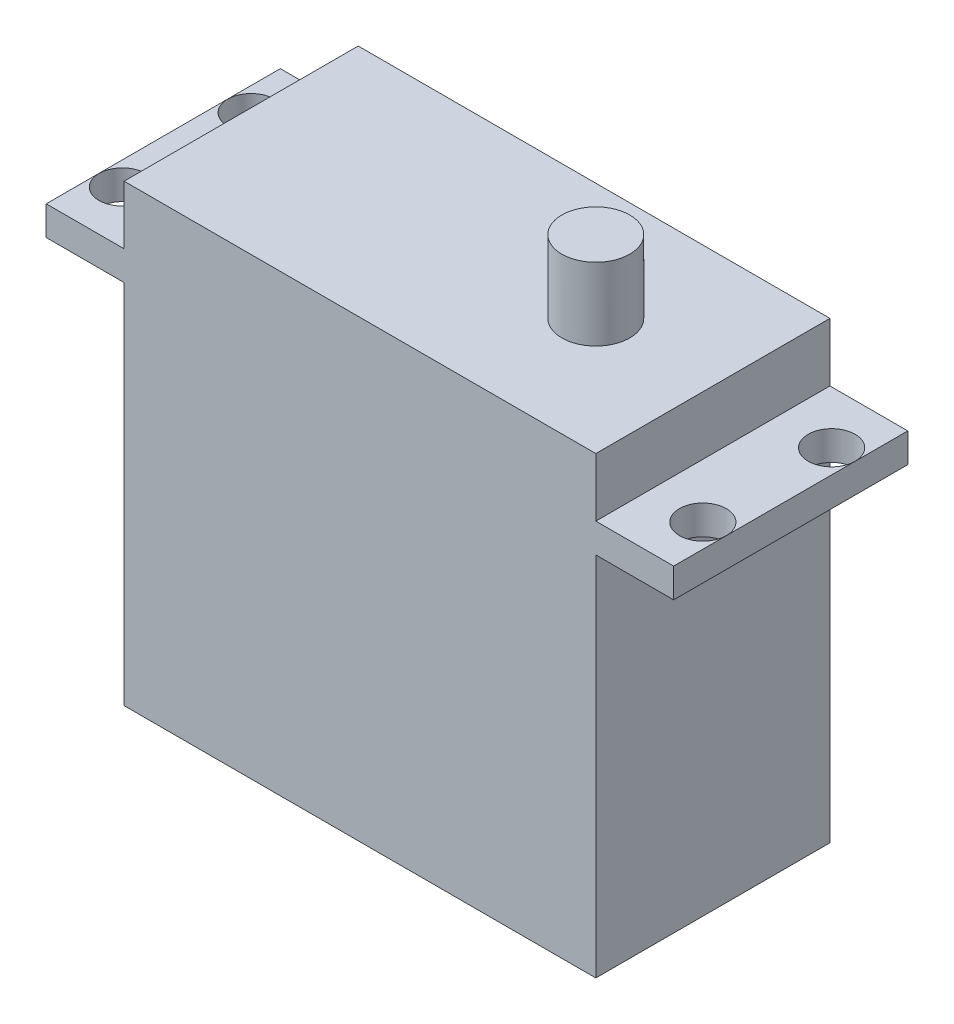
from build123d import *

# Parameters (mm, degrees)
SKETCH1_W           = 40.3
SKETCH1_H           = 20
BOSS_EXTRUDE1_DEPTH = 38.8
SKETCH2_R           = 2.9
BOSS_EXTRUDE2_DEPTH = 6.2
BOSS_EXTRUDE3_START = -5
SKETCH3_W           = 6.65
SKETCH3_H           = 20
SKETCH3_R           = 2
BOSS_EXTRUDE3_DEPTH = 2.5


with BuildPart() as part:
    # Sketch1 → Boss-Extrude1 (new body)
    with BuildSketch(Plane(origin=(0, 0, 0), x_dir=(1, 0, 0), z_dir=(0, 1, 0))):
        Rectangle(SKETCH1_W, SKETCH1_H)
    extrude(amount=BOSS_EXTRUDE1_DEPTH)

    # Sketch2 → Boss-Extrude2 (add)
    with BuildSketch(Plane(origin=(0, 38.8, 0), x_dir=(1, 0, 0), z_dir=(0, 1, 0))):
        with Locations((10.15, 0)):
            Circle(SKETCH2_R)
    extrude(amount=BOSS_EXTRUDE2_DEPTH)

    # Sketch3 → Boss-Extrude3 (add)
    # profile 1 of 2: a face of its own
    with BuildSketch(Plane(origin=(0, 38.8, 0), x_dir=(1, 0, 0), z_dir=(0, 1, 0)).offset(BOSS_EXTRUDE3_START)):
        with Locations((-23.475, 0)):
            Rectangle(SKETCH3_W, SKETCH3_H)
        with Locations((-24.794421729, -5.5)):
            Circle(SKETCH3_R, mode=Mode.SUBTRACT)
        with Locations((-24.794421729, 5.5)):
            Circle(SKETCH3_R, mode=Mode.SUBTRACT)
    # profile 2 of 2: a face of its own
    with BuildSketch(Plane(origin=(0, 38.8, 0), x_dir=(1, 0, 0), z_dir=(0, 1, 0)).offset(BOSS_EXTRUDE3_START)):
        with Locations((23.475, 0)):
            Rectangle(SKETCH3_W, SKETCH3_H)
        with Locations((24.794421729, -5.5)):
            Circle(SKETCH3_R, mode=Mode.SUBTRACT)
        with Locations((24.794421729, 5.5)):
            Circle(SKETCH3_R, mode=Mode.SUBTRACT)
    extrude(amount=-BOSS_EXTRUDE3_DEPTH)


solid = part.part
